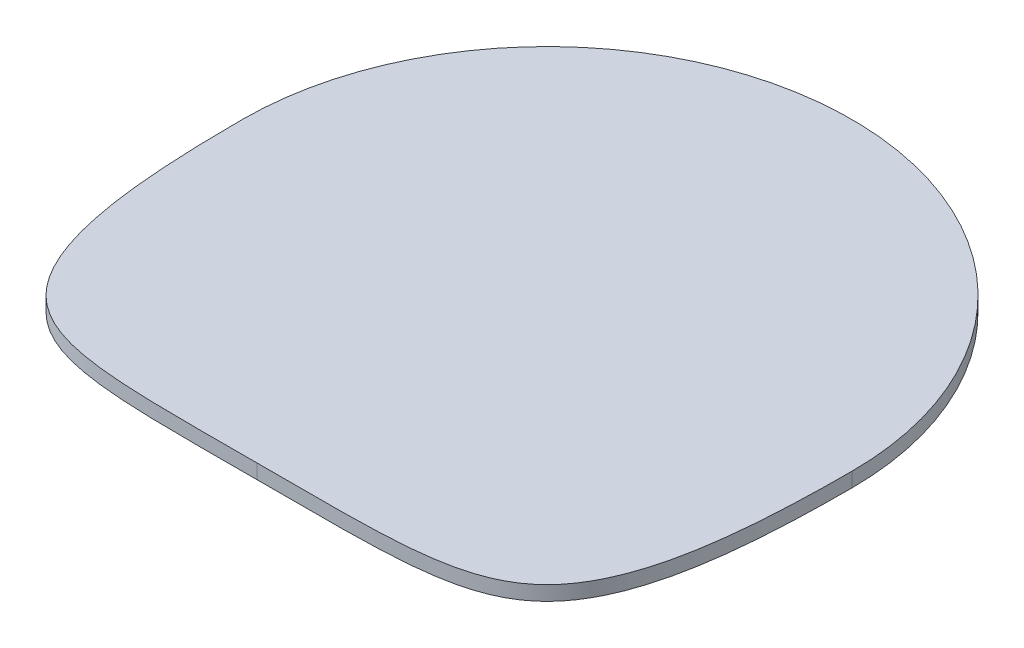
from build123d import *

# Parameters (mm, degrees)
BASE_DEPTH = 6.35


with BuildPart() as part:
    # Sketch1 → Base (new body)
    with BuildSketch(Plane(origin=(0, 0, 0), x_dir=(1, 0, 0), z_dir=(0, 1, 0))):
        with BuildLine():
            ThreePointArc((133.35, 0), (0, 133.35), (-133.35, 0))
            add(Edge.make_bspline(
                [(-133.35, 0), (-133.35, -51.197979728), (-123.803376308, -129.805052089), (-58.427993604, -127), (0, -127)],
                knots=[0, 0, 0, 0, 0.502616309, 1, 1, 1, 1], degree=3))
            add(Edge.make_bspline(
                [(133.35, 0), (133.35, -51.197979728), (123.803376308, -129.805052089), (58.427993604, -127), (0, -127)],
                knots=[0, 0, 0, 0, 0.502616309, 1, 1, 1, 1], degree=3))
        make_face()
    extrude(amount=BASE_DEPTH)


solid = part.part
